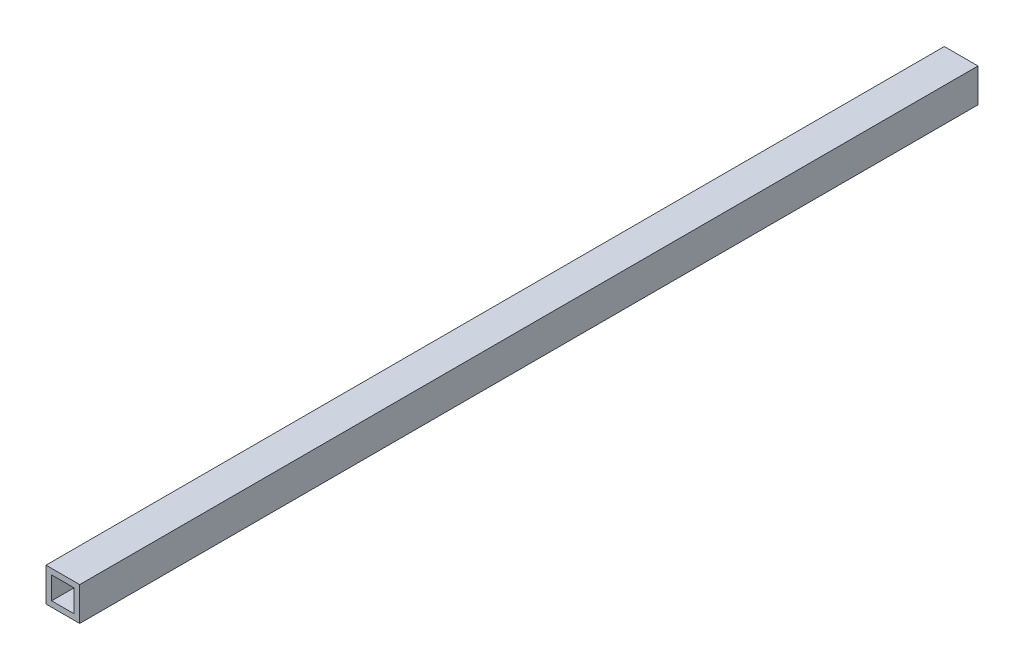
from build123d import *

# Parameters (mm, degrees)
SKETCH1_W           = 19.05
SKETCH1_H           = 19.05
BOSS_EXTRUDE1_DEPTH = 508
CUT_EXTRUDE1_REACH  = 510.179
SKETCH2_W           = 12.7
SKETCH2_H           = 12.7


with BuildPart() as part:
    # Sketch1 → Boss-Extrude1 (new body)
    with BuildSketch(Plane.XY):
        Rectangle(SKETCH1_W, SKETCH1_H)
    extrude(amount=-BOSS_EXTRUDE1_DEPTH)

    # Sketch2 → Cut-Extrude1 (cut, up to next)
    with BuildSketch(Plane.XY, mode=Mode.PRIVATE) as cut_extrude1_sk1:
        Rectangle(SKETCH2_W, SKETCH2_H)
    cut_extrude1_tool1 = extrude(cut_extrude1_sk1.sketch, amount=-CUT_EXTRUDE1_REACH, mode=Mode.PRIVATE) & part.part
    add(cut_extrude1_tool1.solids().sort_by_distance((0, 0, 0))[0], mode=Mode.SUBTRACT)


solid = part.part
